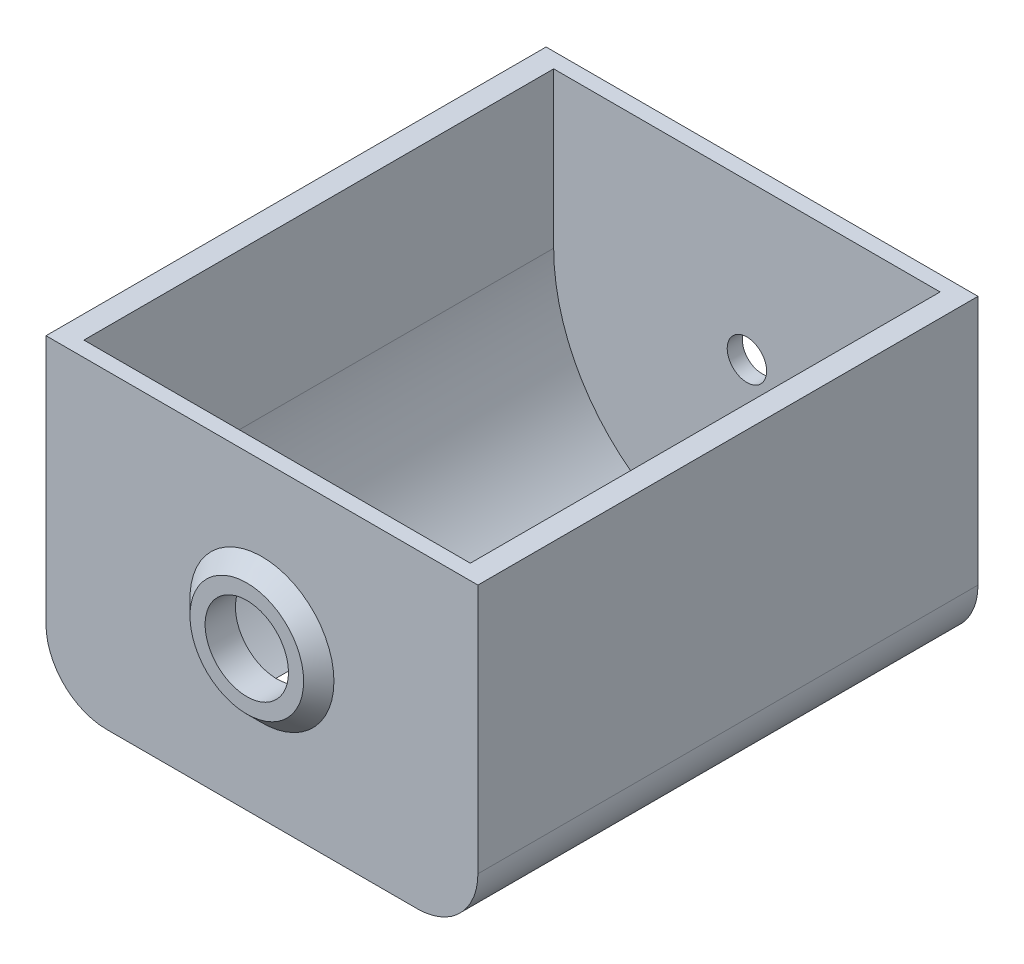
from build123d import *

# Parameters (mm, degrees)
ESTRUSIONE_ESTRUSIONE1_DEPTH   = 62
ESTRUSIONE_ESTRUSIONE1_2_DEPTH = 62
SCHIZZO2_W                     = 57
SCHIZZO2_H                     = 41
SCHIZZO2_R                     = 5.5
ESTRUSIONE_ESTRUSIONE2_DEPTH   = 2
SCHIZZO3_R                     = 7.5
SCHIZZO3_R_2                   = 5.5
ESTRUSIONE_ESTRUSIONE3_DEPTH   = 2
SMUSSO1_SIZE                   = 2
SCHIZZO4_W                     = 57
SCHIZZO4_H                     = 41
SCHIZZO4_R                     = 2.6
ESTRUSIONE_ESTRUSIONE4_DEPTH   = 2
RACCORDO1_R                    = 8


with BuildPart() as part:
    # Schizzo1 → Estrusione-Estrusione1 (new body)
    with BuildSketch(Plane.XY):
        with BuildLine():
            Line((-28.5, -20.5), (-28.5, 20.5))
            Line((-28.5, 20.5), (-25.5, 20.5))
            Line((-25.5, 20.5), (-25.5, 0))
            ThreePointArc((-25.5, 0), (-22.770338685, -11.478748894), (-15.165750888, -20.5))
            Line((-15.165750888, -20.5), (-28.5, -20.5))
        make_face()
    extrude(amount=ESTRUSIONE_ESTRUSIONE1_DEPTH)



with BuildPart() as body_2:
    # Schizzo1 → Estrusione-Estrusione1 2 (new body)
    with BuildSketch(Plane.XY):
        with BuildLine():
            Line((28.5, 20.5), (25.5, 20.5))
            Line((25.5, 20.5), (25.5, 0))
            ThreePointArc((25.5, 0), (22.770338685, -11.478748894), (15.165750888, -20.5))
            Line((15.165750888, -20.5), (28.5, -20.5))
            Line((28.5, -20.5), (28.5, 20.5))
        make_face()
    extrude(amount=ESTRUSIONE_ESTRUSIONE1_2_DEPTH)


with BuildPart() as part_1:
    add(part.part)

    add(body_2.part)  # Estrusione-Estrusione2 merges body 2
    # Schizzo2 → Estrusione-Estrusione2 (add)
    with BuildSketch(Plane.XY.offset(62)):
        Rectangle(SCHIZZO2_W, SCHIZZO2_H)
        Circle(SCHIZZO2_R, mode=Mode.SUBTRACT)
    extrude(amount=ESTRUSIONE_ESTRUSIONE2_DEPTH)

    # Schizzo3 → Estrusione-Estrusione3 (add)
    with BuildSketch(Plane.XY.offset(64)):
        Circle(SCHIZZO3_R)
        Circle(SCHIZZO3_R_2, mode=Mode.SUBTRACT)
    extrude(amount=ESTRUSIONE_ESTRUSIONE3_DEPTH)

    # Smusso1
    smusso1_edges = [part_1.edges().sort_by_distance(p)[0] for p in [
        (-7.5, 0, 64),
    ]]
    chamfer(smusso1_edges, length=SMUSSO1_SIZE - 0.0001)  # a hair under: the kernel refuses the full size

    # Schizzo4 → Estrusione-Estrusione4 (add)
    with BuildSketch(Plane(origin=(0, 0, 0), x_dir=(-1, 0, 0), z_dir=(0, 0, -1))):
        Rectangle(SCHIZZO4_W, SCHIZZO4_H)
        Circle(SCHIZZO4_R, mode=Mode.SUBTRACT)
    extrude(amount=ESTRUSIONE_ESTRUSIONE4_DEPTH)

    # Raccordo1
    raccordo1_edges = [part_1.edges().sort_by_distance(p)[0] for p in [
        (-28.5, -20.5, 31),
        (28.5, -20.5, 31),
    ]]
    fillet(raccordo1_edges, radius=RACCORDO1_R)


solid = part_1.part
